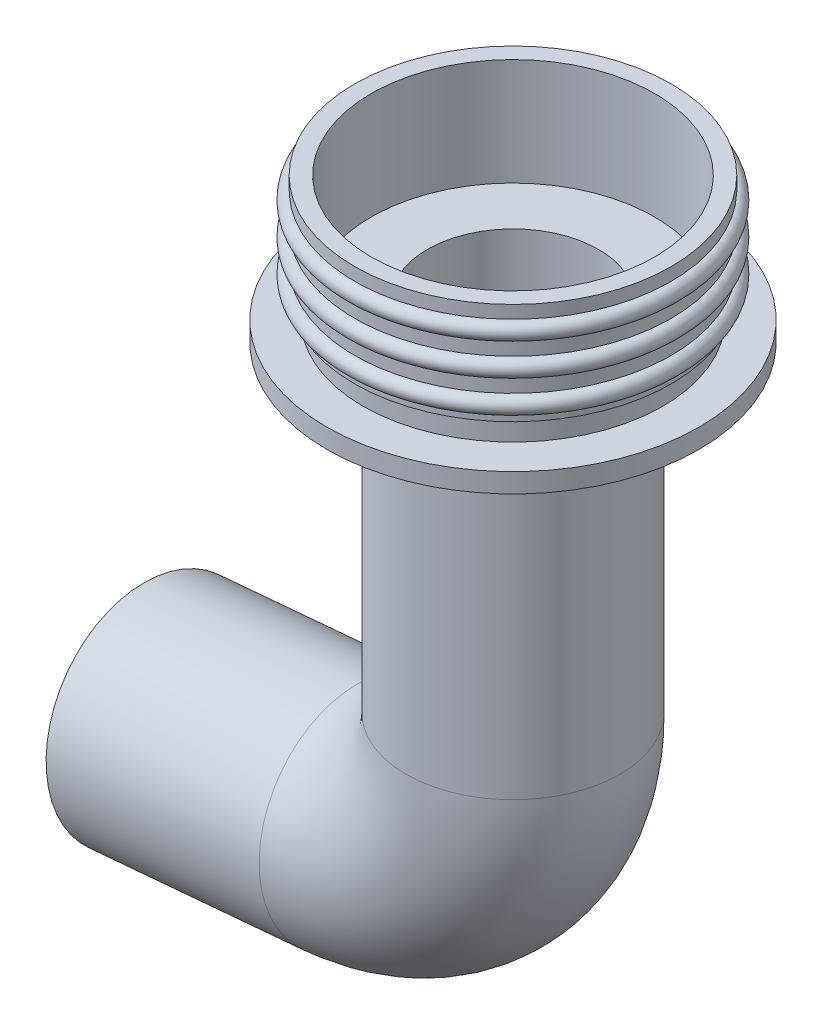
from build123d import *

# Parameters (mm, degrees)
SKETCH1_R           = 17.4
BOSS_EXTRUDE1_DEPTH = 1.81
SKETCH2_R           = 14.02
BOSS_EXTRUDE2_DEPTH = 2.2
SKETCH5_R           = 14.8
BOSS_EXTRUDE3_DEPTH = 9.5
SKETCH6_R           = 13.25
CUT_EXTRUDE1_DEPTH  = 10
SKETCH7_R           = 8
CUT_EXTRUDE2_DEPTH  = 27.561626456
SKETCH10_R          = 10
SKETCH10_R_2        = 8


with BuildPart() as part:
    # Sketch1 → Boss-Extrude1 (new body)
    with BuildSketch(Plane(origin=(0, 0, 0), x_dir=(1, 0, 0), z_dir=(0, 1, 0))):
        Circle(SKETCH1_R)
    extrude(amount=BOSS_EXTRUDE1_DEPTH)

    # Sketch2 → Boss-Extrude2 (add)
    with BuildSketch(Plane(origin=(0, 1.81, 0), x_dir=(1, 0, 0), z_dir=(0, 1, 0))):
        Circle(SKETCH2_R)
    extrude(amount=BOSS_EXTRUDE2_DEPTH)

    # Sketch5 → Boss-Extrude3 (add)
    with BuildSketch(Plane(origin=(0, 4.01, 0), x_dir=(1, 0, 0), z_dir=(0, 1, 0))):
        Circle(SKETCH5_R)
    extrude(amount=BOSS_EXTRUDE3_DEPTH)

    # Sketch6 → Cut-Extrude1 (cut)
    with BuildSketch(Plane(origin=(0, 13.51, 0), x_dir=(1, 0, 0), z_dir=(0, 1, 0))):
        Circle(SKETCH6_R)
    extrude(amount=-CUT_EXTRUDE1_DEPTH, mode=Mode.SUBTRACT)

    # Sketch7 → Cut-Extrude2 (cut, through all)
    with BuildSketch(Plane(origin=(0, 3.51, 0), x_dir=(1, 0, 0), z_dir=(0, 1, 0))):
        Circle(SKETCH7_R)
    extrude(amount=-CUT_EXTRUDE2_DEPTH, mode=Mode.SUBTRACT)

    # Sketch8 → Revolve1 (revolve)
    with BuildSketch(Plane(origin=(0, 0, 0), x_dir=(0, 0, -1), z_dir=(1, 0, 0))):
        with BuildLine():
            Line((-14.8, 12.31), (-14.8, 10.71))
            ThreePointArc((-14.8, 10.71), (-15.6, 11.51), (-14.8, 12.31))
        make_face()
        with BuildLine():
            Line((-14.8, 7.71), (-14.8, 9.31))
            ThreePointArc((-14.8, 9.31), (-15.6, 8.51), (-14.8, 7.71))
        make_face()
        with BuildLine():
            Line((-14.8, 4.71), (-14.8, 6.31))
            ThreePointArc((-14.8, 6.31), (-15.6, 5.51), (-14.8, 4.71))
        make_face()
    revolve(axis=Axis((0, 3.51, 0), (0, 1, 0)))

    # Sweep1: sweep along a path in Sketch9
    with BuildLine(Plane.XY) as sweep1_path:
        Line((0, 0), (0, -30))
        ThreePointArc((0, -30), (-3.940839948, -40.133853114), (-13.692663859, -44.942920471))
        Line((-13.692663859, -44.942920471), (-33.616557821, -46.686035326))
    # Sketch10 → Sweep1 (sweep)
    with BuildSketch(Plane.XZ):
        Circle(SKETCH10_R)
        Circle(SKETCH10_R_2, mode=Mode.SUBTRACT)
    sweep(path=sweep1_path.line)


solid = part.part
